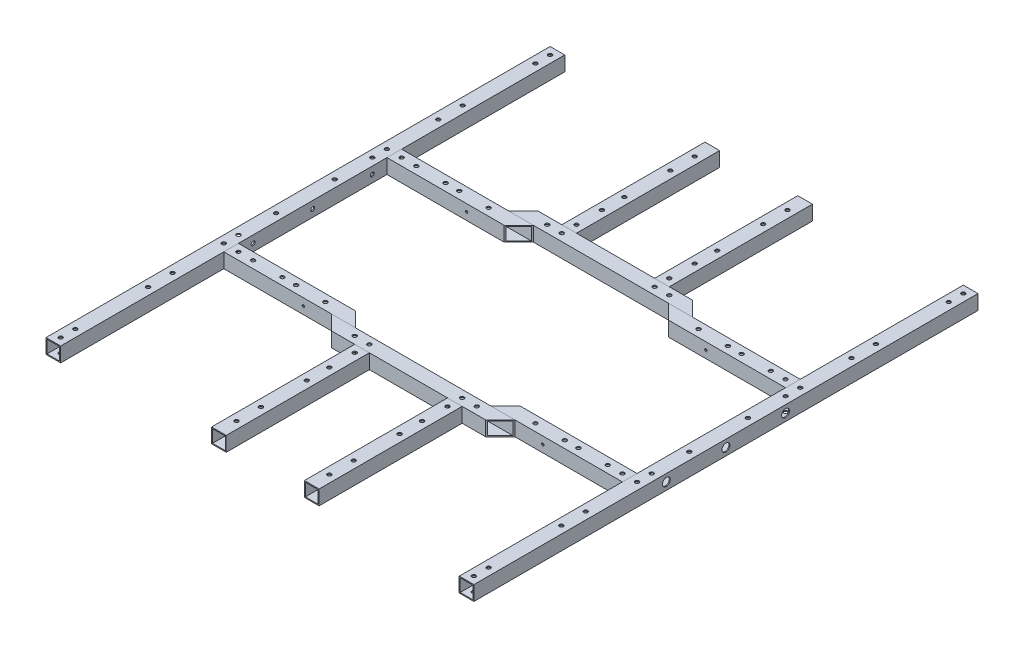
from build123d import *

# Parameters (mm, degrees)
EXTRUDE_START           = -204
EXTRUDE_1_OUTLINE_W     = 15
EXTRUDE_1_OUTLINE_H     = 15
EXTRUDE_1_OUTLINE_W_2   = 13
EXTRUDE_1_OUTLINE_H_2   = 13
EXTRUDE_1_DEPTH         = 408
EXTRUDE_1_2_OUTLINE_W   = 15
EXTRUDE_1_2_OUTLINE_H   = 15
EXTRUDE_1_2_OUTLINE_W_2 = 13
EXTRUDE_1_2_OUTLINE_H_2 = 13
EXTRUDE_1_2_DEPTH       = 408
EXTRUDE_START_2         = -258
EXTRUDE_2_OUTLINE_W     = 15
EXTRUDE_2_OUTLINE_H     = 15
EXTRUDE_2_OUTLINE_W_2   = 13
EXTRUDE_2_OUTLINE_H_2   = 13
EXTRUDE_2_DEPTH         = 516
EXTRUDE_2_2_OUTLINE_W   = 15
EXTRUDE_2_2_OUTLINE_H   = 15
EXTRUDE_2_2_OUTLINE_W_2 = 13
EXTRUDE_2_2_OUTLINE_H_2 = 13
EXTRUDE_2_2_DEPTH       = 516
EXTRUDE_3_OUTLINE_W     = 15
EXTRUDE_3_OUTLINE_H     = 15
EXTRUDE_3_OUTLINE_W_2   = 13
EXTRUDE_3_OUTLINE_H_2   = 13
EXTRUDE_3_DEPTH         = 146.5
EXTRUDE_3_2_OUTLINE_W   = 15
EXTRUDE_3_2_OUTLINE_H   = 15
EXTRUDE_3_2_OUTLINE_W_2 = 13
EXTRUDE_3_2_OUTLINE_H_2 = 13
EXTRUDE_3_2_DEPTH       = 146.5
EXTRUDE_1_3_DEPTH       = 7.5
CUT_EXTRUDE_6_DEPTH     = 339.747693719
SHELL_1_T               = -1
SKETCH_6_R              = 2
CUT_EXTRUDE_2_DEPTH     = 339.747693719
SKETCH_9_R              = 1.25
CUT_EXTRUDE_4_DEPTH     = 413.090099371
SKETCH_10_R             = 2
CUT_EXTRUDE_5_DEPTH     = 509.393794219
SKETCH_7_R              = 4
CUT_EXTRUDE_3_DEPTH     = 1
MIRROR_START            = -8
MIRROR_3_OUTLINE_R      = 2
MIRROR_3_DEPTH          = 16
MIRROR_3_2_OUTLINE_R    = 2
MIRROR_3_2_DEPTH        = 16
MIRROR_3_3_OUTLINE_R    = 2
MIRROR_3_3_DEPTH        = 16


with BuildPart() as part:
    # Extrude 1: read off the stored shape, not the designer's step
    # Extrude 1 outline → Extrude 1 (new body)
    with BuildSketch(Plane(origin=(0, 0, 0), x_dir=(0, 0, -1), z_dir=(1, 0, 0)).offset(EXTRUDE_START)):
        with Locations((98.5, 0)):
            Rectangle(EXTRUDE_1_OUTLINE_W, EXTRUDE_1_OUTLINE_H)
        with Locations((98.5, 0)):
            Rectangle(EXTRUDE_1_OUTLINE_W_2, EXTRUDE_1_OUTLINE_H_2, mode=Mode.SUBTRACT)
    extrude(amount=EXTRUDE_1_DEPTH)


with BuildPart() as body_2:
    # Extrude 1 2 outline → Extrude 1 2 (new body)
    with BuildSketch(Plane(origin=(0, 0, 0), x_dir=(0, 0, -1), z_dir=(1, 0, 0)).offset(EXTRUDE_START)):
        with Locations((-98.5, 0)):
            Rectangle(EXTRUDE_1_2_OUTLINE_W, EXTRUDE_1_2_OUTLINE_H)
        with Locations((-98.5, 0)):
            Rectangle(EXTRUDE_1_2_OUTLINE_W_2, EXTRUDE_1_2_OUTLINE_H_2, mode=Mode.SUBTRACT)
    extrude(amount=EXTRUDE_1_2_DEPTH)


with BuildPart() as body_3:
    # 拉伸-薄壁2: read off the stored shape, not the designer's step
    # 拉伸-薄壁2 outline → 拉伸-薄壁2 (new body)
    with BuildSketch(Plane.XY.offset(EXTRUDE_START_2)):
        with Locations((-211.5, 0)):
            Rectangle(EXTRUDE_2_OUTLINE_W, EXTRUDE_2_OUTLINE_H)
        with Locations((-211.5, 0)):
            Rectangle(EXTRUDE_2_OUTLINE_W_2, EXTRUDE_2_OUTLINE_H_2, mode=Mode.SUBTRACT)
    extrude(amount=EXTRUDE_2_DEPTH)


with BuildPart() as body_4:
    # Extrude 2 2 outline → Extrude 2 2 (new body)
    with BuildSketch(Plane.XY.offset(EXTRUDE_START_2)):
        with Locations((211.5, 0)):
            Rectangle(EXTRUDE_2_2_OUTLINE_W, EXTRUDE_2_2_OUTLINE_H)
        with Locations((211.5, 0)):
            Rectangle(EXTRUDE_2_2_OUTLINE_W_2, EXTRUDE_2_2_OUTLINE_H_2, mode=Mode.SUBTRACT)
    extrude(amount=EXTRUDE_2_2_DEPTH)


with BuildPart() as body_5:
    # 拉伸-薄壁3: read off the stored shape, not the designer's step
    # 拉伸-薄壁3 outline → 拉伸-薄壁3 (new body)
    with BuildSketch(Plane.XY.offset(106)):
        with Locations((-47.5, 0)):
            Rectangle(EXTRUDE_3_OUTLINE_W, EXTRUDE_3_OUTLINE_H)
        with Locations((-47.5, 0)):
            Rectangle(EXTRUDE_3_OUTLINE_W_2, EXTRUDE_3_OUTLINE_H_2, mode=Mode.SUBTRACT)
    extrude(amount=EXTRUDE_3_DEPTH)


with BuildPart() as body_6:
    # Extrude 3 2 outline → Extrude 3 2 (new body)
    with BuildSketch(Plane.XY.offset(106)):
        with Locations((47.5, 0)):
            Rectangle(EXTRUDE_3_2_OUTLINE_W, EXTRUDE_3_2_OUTLINE_H)
        with Locations((47.5, 0)):
            Rectangle(EXTRUDE_3_2_OUTLINE_W_2, EXTRUDE_3_2_OUTLINE_H_2, mode=Mode.SUBTRACT)
    extrude(amount=EXTRUDE_3_2_DEPTH)


with BuildPart() as body_7:
    # 草图11 → Extrude 1 3 (new, symmetric)
    with BuildSketch(Plane(origin=(0, 0, 0), x_dir=(1, 0, 0), z_dir=(0, 1, 0))):
        Polygon((204, -91), (69, -91), (84, -76), (204, -76), align=None)
    extrude(amount=EXTRUDE_1_3_DEPTH, both=True)

    # 抽壳1
    shell_1_openings = [body_7.faces().sort_by_distance(p)[0] for p in [
        (76.5, 0, 83.5),
        (204, 0, 83.5),
    ]]
    offset(amount=SHELL_1_T, openings=shell_1_openings, kind=Kind.INTERSECTION)


with BuildPart() as cut_extrude_6_tool:
    # 草图12 → 切除-拉伸6 (new, through all)
    with BuildSketch(Plane(origin=(0, 7.5, 0), x_dir=(1, 0, 0), z_dir=(0, 1, 0))):
        Polygon((94, -91), (79, -106), (204, -106), (204, -91), align=None)
        Polygon((-204, -91), (-94, -91), (-79, -106), (-204, -106), align=None)
        Polygon((-94, 91), (-79, 106), (-204, 106), (-204, 91), align=None)
        Polygon((204, 91), (94, 91), (79, 106), (204, 106), align=None)
    extrude(amount=-CUT_EXTRUDE_6_DEPTH)


with BuildPart() as part_1:
    add(part.part)

    # 切除-拉伸6: cut by cut_extrude_6_tool
    add(cut_extrude_6_tool.part, mode=Mode.SUBTRACT)

    # Mirror 3 3 outline → Mirror 3 3 (cut)
    with BuildSketch(Plane(origin=(0, 0, 0), x_dir=(1, 0, 0), z_dir=(0, 1, 0)).offset(MIRROR_START)):
        with Locations((-62.5, 98.5)):
            Circle(MIRROR_3_3_OUTLINE_R)
        with Locations((62.5, 98.5)):
            Circle(MIRROR_3_3_OUTLINE_R)
        with Locations((47.5, 98.5)):
            Circle(MIRROR_3_3_OUTLINE_R)
        with Locations((-47.5, 98.5)):
            Circle(MIRROR_3_3_OUTLINE_R)
    extrude(amount=MIRROR_3_3_DEPTH, mode=Mode.SUBTRACT)


with BuildPart() as body_2_1:
    add(body_2.part)

    # 切除-拉伸6: cut by cut_extrude_6_tool
    add(cut_extrude_6_tool.part, mode=Mode.SUBTRACT)


with BuildPart() as cut_extrude_2_tool:
    # 草图6 → 切除-拉伸2 (new, through all)
    with BuildSketch(Plane(origin=(0, 7.5, 0), x_dir=(1, 0, 0), z_dir=(0, 1, 0))):
        with Locations(Location((196.5, -83.5, 0), (0, 0, 270))):
            Circle(SKETCH_6_R)
        with Locations(Location((211.5, -83.5, 0), (0, 0, 270))):
            Circle(SKETCH_6_R)
        with Locations(Location((211.5, -68.5, 0), (0, 0, 270))):
            Circle(SKETCH_6_R)
        with Locations(Location((211.5, -250.5, 0), (0, 0, 270))):
            Circle(SKETCH_6_R)
        with Locations(Location((47.5, -162.5, 0), (0, 0, 270))):
            Circle(SKETCH_6_R)
        with Locations(Location((47.5, -209.5, 0), (0, 0, 270))):
            Circle(SKETCH_6_R)
        with Locations(Location((47.5, -234.5, 0), (0, 0, 270))):
            Circle(SKETCH_6_R)
        with Locations(Location((211.5, -235.5, 0), (0, 0, 270))):
            Circle(SKETCH_6_R)
        with Locations(Location((47.5, -139.5, 0), (0, 0, 270))):
            Circle(SKETCH_6_R)
        with Locations(Location((47.5, -113.5, 0), (0, 0, 270))):
            Circle(SKETCH_6_R)
        with Locations(Location((47.5, -98.5, 0), (0, 0, 270))):
            Circle(SKETCH_6_R)
        with Locations(Location((62.5, -98.5, 0), (0, 0, 270))):
            Circle(SKETCH_6_R)
        with Locations(Location((181.5, -83.5, 0), (0, 0, 270))):
            Circle(SKETCH_6_R)
        with Locations(Location((137.5, -83.5, 0), (0, 0, 270))):
            Circle(SKETCH_6_R)
        with Locations(Location((211.5, -30, 0), (0, 0, 270))):
            Circle(SKETCH_6_R)
        with Locations(Location((151.5, -83.5, 0), (0, 0, 270))):
            Circle(SKETCH_6_R)
        with Locations(Location((107.5, -83.5, 0), (0, 0, 270))):
            Circle(SKETCH_6_R)
        with Locations(Location((211.5, -136, 0), (0, 0, 270))):
            Circle(SKETCH_6_R)
        with Locations(Location((211.5, -161, 0), (0, 0, 270))):
            Circle(SKETCH_6_R)
    cut_extrude_2 = extrude(amount=-CUT_EXTRUDE_2_DEPTH)


with BuildPart() as body_2_2:
    add(body_2_1.part)

    # 切除-拉伸2: cut by cut_extrude_2_tool
    add(cut_extrude_2_tool.part, mode=Mode.SUBTRACT)


with BuildPart() as body_4_1:
    add(body_4.part)

    # 切除-拉伸2: cut by cut_extrude_2_tool
    add(cut_extrude_2_tool.part, mode=Mode.SUBTRACT)

    # 草图10 → 切除-拉伸5 (cut, through all)
    with BuildSketch(Plane(origin=(219, 0, 0), x_dir=(0, 0, -1), z_dir=(1, 0, 0))):
        Circle(SKETCH_10_R)
        with Locations((-61, 0)):
            Circle(SKETCH_10_R)
        with Locations(Location((61, 0, 0), (0, 0, 180))):
            Circle(SKETCH_10_R)
    cut_extrude_5 = extrude(amount=-CUT_EXTRUDE_5_DEPTH, mode=Mode.SUBTRACT)

    # 草图7 → 切除-拉伸3 (cut)
    with BuildSketch(Plane(origin=(219, 0, 0), x_dir=(0, 0, -1), z_dir=(1, 0, 0))):
        with Locations((-61, 0)):
            Circle(SKETCH_7_R)
        Circle(SKETCH_7_R)
        with Locations((61, 0)):
            Circle(SKETCH_7_R)
    cut_extrude_3 = extrude(amount=-CUT_EXTRUDE_3_DEPTH, mode=Mode.SUBTRACT)

    # Mirror 3 2 outline → Mirror 3 2 (cut)
    with BuildSketch(Plane(origin=(0, 0, 0), x_dir=(1, 0, 0), z_dir=(0, 1, 0)).offset(MIRROR_START)):
        with Locations((211.5, 30)):
            Circle(MIRROR_3_2_OUTLINE_R)
        with Locations((211.5, 161)):
            Circle(MIRROR_3_2_OUTLINE_R)
        with Locations((211.5, 235.5)):
            Circle(MIRROR_3_2_OUTLINE_R)
        with Locations((211.5, 250.5)):
            Circle(MIRROR_3_2_OUTLINE_R)
        with Locations((211.5, 83.5)):
            Circle(MIRROR_3_2_OUTLINE_R)
        with Locations((211.5, 68.5)):
            Circle(MIRROR_3_2_OUTLINE_R)
        with Locations((211.5, 136)):
            Circle(MIRROR_3_2_OUTLINE_R)
    extrude(amount=MIRROR_3_2_DEPTH, mode=Mode.SUBTRACT)


with BuildPart() as body_6_1:
    add(body_6.part)

    # 切除-拉伸2: cut by cut_extrude_2_tool
    add(cut_extrude_2_tool.part, mode=Mode.SUBTRACT)


with BuildPart() as body_7_1:
    add(body_7.part)

    # 切除-拉伸2: cut by cut_extrude_2_tool
    add(cut_extrude_2_tool.part, mode=Mode.SUBTRACT)

    # 草图9 → 切除-拉伸4 (cut, through all)
    with BuildSketch(Plane.XY.offset(91)):
        with Locations((122.5, 0)):
            Circle(SKETCH_9_R)
    cut_extrude_4 = extrude(amount=-CUT_EXTRUDE_4_DEPTH, mode=Mode.SUBTRACT)


with BuildPart() as mirror_2_tool:
    # 镜向2: 切除-拉伸2, 切除-拉伸4, 切除-拉伸5, 切除-拉伸3 across plane
    add(cut_extrude_2.mirror(Plane(origin=(0, 0, 0), x_dir=(0, 0, 1), z_dir=(1, 0, 0))))
    add(cut_extrude_4.mirror(Plane(origin=(0, 0, 0), x_dir=(0, 0, 1), z_dir=(1, 0, 0))))
    add(cut_extrude_5.mirror(Plane(origin=(0, 0, 0), x_dir=(0, 0, 1), z_dir=(1, 0, 0))))
    add(cut_extrude_3.mirror(Plane(origin=(0, 0, 0), x_dir=(0, 0, 1), z_dir=(1, 0, 0))))


with BuildPart() as body_2_3:
    add(body_2_2.part)

    # 镜向2: cut by mirror_2_tool
    add(mirror_2_tool.part, mode=Mode.SUBTRACT)


with BuildPart() as body_3_1:
    add(body_3.part)

    # 镜向2: cut by mirror_2_tool
    add(mirror_2_tool.part, mode=Mode.SUBTRACT)

    # 镜向3: read off the stored shape, not the designer's step
    # 镜向3 outline → 镜向3 (cut)
    with BuildSketch(Plane(origin=(0, 0, 0), x_dir=(1, 0, 0), z_dir=(0, 1, 0)).offset(MIRROR_START)):
        with Locations((-211.5, 30)):
            Circle(MIRROR_3_OUTLINE_R)
        with Locations((-211.5, 161)):
            Circle(MIRROR_3_OUTLINE_R)
        with Locations((-211.5, 235.5)):
            Circle(MIRROR_3_OUTLINE_R)
        with Locations((-211.5, 250.5)):
            Circle(MIRROR_3_OUTLINE_R)
        with Locations((-211.5, 83.5)):
            Circle(MIRROR_3_OUTLINE_R)
        with Locations((-211.5, 68.5)):
            Circle(MIRROR_3_OUTLINE_R)
        with Locations((-211.5, 136)):
            Circle(MIRROR_3_OUTLINE_R)
    extrude(amount=MIRROR_3_DEPTH, mode=Mode.SUBTRACT)


with BuildPart() as body_5_1:
    add(body_5.part)

    # 镜向2: cut by mirror_2_tool
    add(mirror_2_tool.part, mode=Mode.SUBTRACT)


with BuildPart() as body_8:
    # 镜向1: mirrored copy
    add(body_5_1.part.mirror(Plane.XY))


with BuildPart() as body_9:
    # Mirror 1 2: mirrored copy
    add(body_6_1.part.mirror(Plane.XY))


with BuildPart() as body_10:
    # Mirror 1 3: mirrored copy
    add(body_7_1.part.mirror(Plane.XY))


with BuildPart() as body_11:
    # 镜向4: mirrored copy
    add(body_7_1.part.mirror(Plane(origin=(0, 0, 0), x_dir=(0, 0, 1), z_dir=(1, 0, 0))))


with BuildPart() as body_12:
    # Mirror 4 2: mirrored copy
    add(body_10.part.mirror(Plane(origin=(0, 0, 0), x_dir=(0, 0, 1), z_dir=(1, 0, 0))))


solid = Compound([part_1.part, body_4_1.part, body_6_1.part, body_7_1.part, body_2_3.part, body_3_1.part, body_5_1.part, body_8.part, body_9.part, body_10.part, body_11.part, body_12.part])
